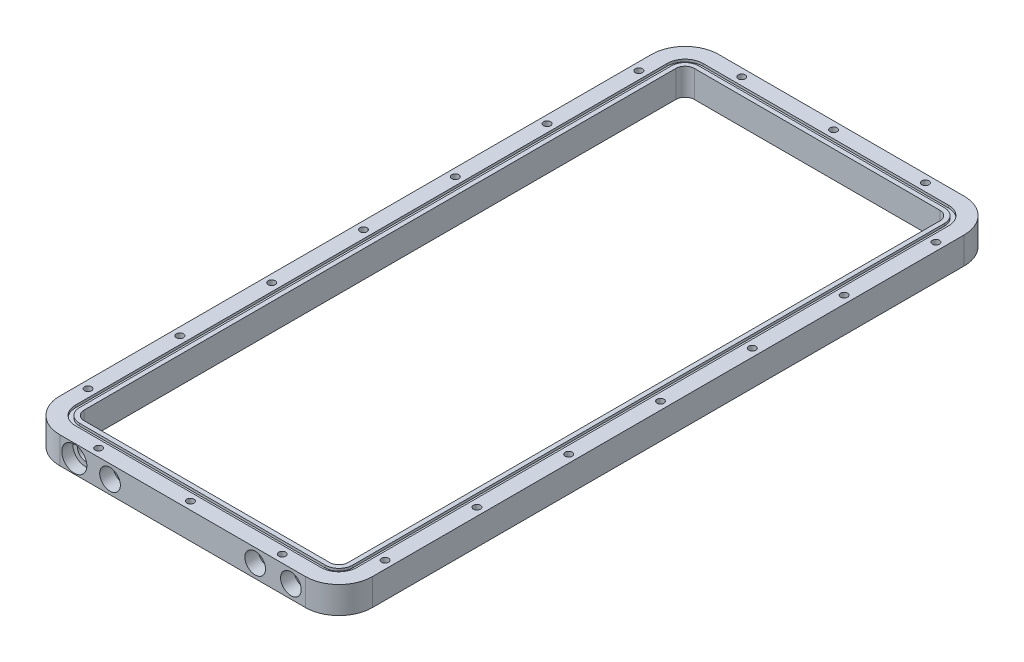
from build123d import *

# Parameters (mm, degrees)
SKETCH1_W                      = 304.8
SKETCH1_H                      = 609.6
F_1_X2_HDPE_STOCK_DEPTH        = 12.05
BASE_ENCLOSURE_DIMS_DEPTH      = 342.627882352
BASE_ENCLOSURE_DIMS_DEPTH_BACK = 342.627882352
SKETCH2_W                      = 304.8
SKETCH2_H                      = 609.6
SKETCH2_W_2                    = 280
SKETCH2_H_2                    = 590
FILLET1_R                      = 30
SKETCH3_R                      = 3.15
CUT_EXTRUDE4_DEPTH             = 328.422983311
CRVPATTERN1_START              = -13
CRVPATTERN1_OUTLINE_R          = 3.15
CRVPATTERN1_DEPTH              = 26
ORING_GROOVE_DEPTH             = 2.2
CUT_EXTRUDE6_DEPTH             = 328.422983311
CUT_EXTRUDE6_DEPTH_BACK        = 328.422983311
CUT_EXTRUDE7_REACH             = 608.502
SKETCH7_R                      = 5.05
SKETCH7_R_2                    = 7.05
SKETCH8_R                      = 11.25
CUT_EXTRUDE8_DEPTH             = 10
SKETCH9_R                      = 9.25
CUT_EXTRUDE9_DEPTH             = 12


with BuildPart() as part:
    # Sketch1 → 1"x2" HDPE Stock (new, symmetric)
    with BuildSketch(Plane(origin=(0, 0, 0), x_dir=(1, 0, 0), z_dir=(0, 1, 0))):
        Rectangle(SKETCH1_W, SKETCH1_H)
    extrude(amount=F_1_X2_HDPE_STOCK_DEPTH, both=True)

    # Sketch2 → Base Enclosure Dims (cut, two sides: drawn at the far end of the back side and taken through both)
    with BuildSketch(Plane(origin=(0, 12.05, 0), x_dir=(1, 0, 0), z_dir=(0, 1, 0)).offset(-BASE_ENCLOSURE_DIMS_DEPTH_BACK)):
        Rectangle(SKETCH2_W, SKETCH2_H)
        Rectangle(SKETCH2_W_2, SKETCH2_H_2, mode=Mode.SUBTRACT)
    extrude(amount=BASE_ENCLOSURE_DIMS_DEPTH + BASE_ENCLOSURE_DIMS_DEPTH_BACK, mode=Mode.SUBTRACT)

    # Fillet1
    fillet1_edges = [part.edges().sort_by_distance(p)[0] for p in [
        (140, 0, 295),
        (140, 0, -295),
        (-140, 0, -295),
        (-140, 0, 295),
    ]]
    fillet(fillet1_edges, radius=FILLET1_R)

    # Sketch3 → Cut-Extrude4 (cut, symmetric)
    with BuildSketch(Plane(origin=(0, 12.05, 0), x_dir=(1, 0, 0), z_dir=(0, 1, 0))):
        with Locations(Location((0, -288, 0), (0, 0, 270))):
            Circle(SKETCH3_R)
    extrude(amount=CUT_EXTRUDE4_DEPTH, both=True, mode=Mode.SUBTRACT)

    # CrvPattern1: read off the stored shape, not the designer's step
    # CrvPattern1 outline → CrvPattern1 (cut)
    with BuildSketch(Plane(origin=(0, 0, 0), x_dir=(1, 0, 0), z_dir=(0, 1, 0)).offset(CRVPATTERN1_START)):
        with Locations((82.225663103, -288)):
            Circle(CRVPATTERN1_OUTLINE_R)
        with Locations((-82.225663103, -288)):
            Circle(CRVPATTERN1_OUTLINE_R)
        with Locations((-133, -246.67698931)):
            Circle(CRVPATTERN1_OUTLINE_R)
        with Locations((-133, -164.451326207)):
            Circle(CRVPATTERN1_OUTLINE_R)
        with Locations((-133, -82.225663103)):
            Circle(CRVPATTERN1_OUTLINE_R)
        with Locations((-133, 0)):
            Circle(CRVPATTERN1_OUTLINE_R)
        with Locations((-133, 82.225663103)):
            Circle(CRVPATTERN1_OUTLINE_R)
        with Locations((-133, 164.451326207)):
            Circle(CRVPATTERN1_OUTLINE_R)
        with Locations((-133, 246.67698931)):
            Circle(CRVPATTERN1_OUTLINE_R)
        with Locations((-82.225663103, 288)):
            Circle(CRVPATTERN1_OUTLINE_R)
        with Locations((0, 288)):
            Circle(CRVPATTERN1_OUTLINE_R)
        with Locations((82.225663103, 288)):
            Circle(CRVPATTERN1_OUTLINE_R)
        with Locations((133, 246.67698931)):
            Circle(CRVPATTERN1_OUTLINE_R)
        with Locations((133, 164.451326207)):
            Circle(CRVPATTERN1_OUTLINE_R)
        with Locations((133, 82.225663103)):
            Circle(CRVPATTERN1_OUTLINE_R)
        with Locations((133, 0)):
            Circle(CRVPATTERN1_OUTLINE_R)
        with Locations((133, -82.225663103)):
            Circle(CRVPATTERN1_OUTLINE_R)
        with Locations((133, -164.451326207)):
            Circle(CRVPATTERN1_OUTLINE_R)
        with Locations((133, -246.67698931)):
            Circle(CRVPATTERN1_OUTLINE_R)
    extrude(amount=CRVPATTERN1_DEPTH, mode=Mode.SUBTRACT)

    # Sketch5 → Oring Groove (cut)
    with BuildSketch(Plane(origin=(0, 12.05, 0), x_dir=(1, 0, 0), z_dir=(0, 1, 0))):
        with BuildLine():
            Line((-126, 265), (-126, -265))
            ThreePointArc((-126, -265), (-121.313708499, -276.313708499), (-110, -281))
            Line((-110, -281), (110, -281))
            ThreePointArc((110, -281), (121.313708499, -276.313708499), (126, -265))
            Line((126, -265), (126, 265))
            ThreePointArc((126, 265), (121.313708499, 276.313708499), (110, 281))
            Line((110, 281), (-110, 281))
            ThreePointArc((-110, 281), (-121.313708499, 276.313708499), (-126, 265))
        make_face()
        with BuildLine():
            Line((122.25, -265), (122.25, 265))
            ThreePointArc((122.25, 265), (118.66205807, 273.66205807), (110, 277.25))
            Line((110, 277.25), (-110, 277.25))
            ThreePointArc((-110, 277.25), (-118.66205807, 273.66205807), (-122.25, 265))
            Line((-122.25, 265), (-122.25, -265))
            ThreePointArc((-122.25, -265), (-118.66205807, -273.66205807), (-110, -277.25))
            Line((-110, -277.25), (110, -277.25))
            ThreePointArc((110, -277.25), (118.66205807, -273.66205807), (122.25, -265))
        make_face(mode=Mode.SUBTRACT)
    oring_groove = extrude(amount=-ORING_GROOVE_DEPTH, mode=Mode.SUBTRACT)

    # Sketch6 → Cut-Extrude6 (cut, two sides: drawn at the far end of the back side and taken through both)
    with BuildSketch(Plane(origin=(0, 12.05, 0), x_dir=(1, 0, 0), z_dir=(0, 1, 0)).offset(-CUT_EXTRUDE6_DEPTH_BACK)):
        with BuildLine():
            Line((118.25, -265), (118.25, 265))
            ThreePointArc((118.25, 265), (115.833630945, 270.833630945), (110, 273.25))
            Line((110, 273.25), (-110, 273.25))
            ThreePointArc((-110, 273.25), (-115.833630945, 270.833630945), (-118.25, 265))
            Line((-118.25, 265), (-118.25, -265))
            ThreePointArc((-118.25, -265), (-115.833630945, -270.833630945), (-110, -273.25))
            Line((-110, -273.25), (110, -273.25))
            ThreePointArc((110, -273.25), (115.833630945, -270.833630945), (118.25, -265))
        make_face()
    extrude(amount=CUT_EXTRUDE6_DEPTH + CUT_EXTRUDE6_DEPTH_BACK, mode=Mode.SUBTRACT)

    # Mirror1: Oring Groove across plane
    add(oring_groove.mirror(Plane.ZX), mode=Mode.SUBTRACT)

    # Sketch7 → Cut-Extrude7 (cut, up to next)
    with BuildSketch(Plane.XY.offset(295), mode=Mode.PRIVATE) as cut_extrude7_sk1:
        with Locations((-65, 0)):
            Circle(SKETCH7_R)
    cut_extrude7_tool1 = extrude(cut_extrude7_sk1.sketch, amount=-CUT_EXTRUDE7_REACH, mode=Mode.PRIVATE) & part.part
    # Sketch7 → Cut-Extrude7 (cut, up to next)
    with BuildSketch(Plane.XY.offset(295), mode=Mode.PRIVATE) as cut_extrude7_sk2:
        with Locations((-97, 0)):
            Circle(SKETCH7_R_2)
    cut_extrude7_tool2 = extrude(cut_extrude7_sk2.sketch, amount=-CUT_EXTRUDE7_REACH, mode=Mode.PRIVATE) & part.part
    # Sketch7 → Cut-Extrude7 (cut, up to next)
    with BuildSketch(Plane.XY.offset(295), mode=Mode.PRIVATE) as cut_extrude7_sk3:
        with Locations((97, 0)):
            Circle(SKETCH7_R)
    cut_extrude7_tool3 = extrude(cut_extrude7_sk3.sketch, amount=-CUT_EXTRUDE7_REACH, mode=Mode.PRIVATE) & part.part
    # Sketch7 → Cut-Extrude7 (cut, up to next)
    with BuildSketch(Plane.XY.offset(295), mode=Mode.PRIVATE) as cut_extrude7_sk4:
        with Locations((65, 0)):
            Circle(SKETCH7_R)
    cut_extrude7_tool4 = extrude(cut_extrude7_sk4.sketch, amount=-CUT_EXTRUDE7_REACH, mode=Mode.PRIVATE) & part.part
    add(cut_extrude7_tool1.solids().sort_by_distance((-65, 0, 295))[0], mode=Mode.SUBTRACT)
    add(cut_extrude7_tool2.solids().sort_by_distance((-97, 0, 295))[0], mode=Mode.SUBTRACT)
    add(cut_extrude7_tool3.solids().sort_by_distance((97, 0, 295))[0], mode=Mode.SUBTRACT)
    add(cut_extrude7_tool4.solids().sort_by_distance((65, 0, 295))[0], mode=Mode.SUBTRACT)

    # Sketch8 → Cut-Extrude8 (cut)
    with BuildSketch(Plane.XY.offset(295)):
        with Locations((-97, 0)):
            Circle(SKETCH8_R)
    extrude(amount=-CUT_EXTRUDE8_DEPTH, mode=Mode.SUBTRACT)

    # Sketch9 → Cut-Extrude9 (cut)
    with BuildSketch(Plane.XY.offset(295)):
        with Locations((-65, 0)):
            Circle(SKETCH9_R)
        with Locations((65, 0)):
            Circle(SKETCH9_R)
        with Locations((97, 0)):
            Circle(SKETCH9_R)
    extrude(amount=-CUT_EXTRUDE9_DEPTH, mode=Mode.SUBTRACT)


solid = part.part
